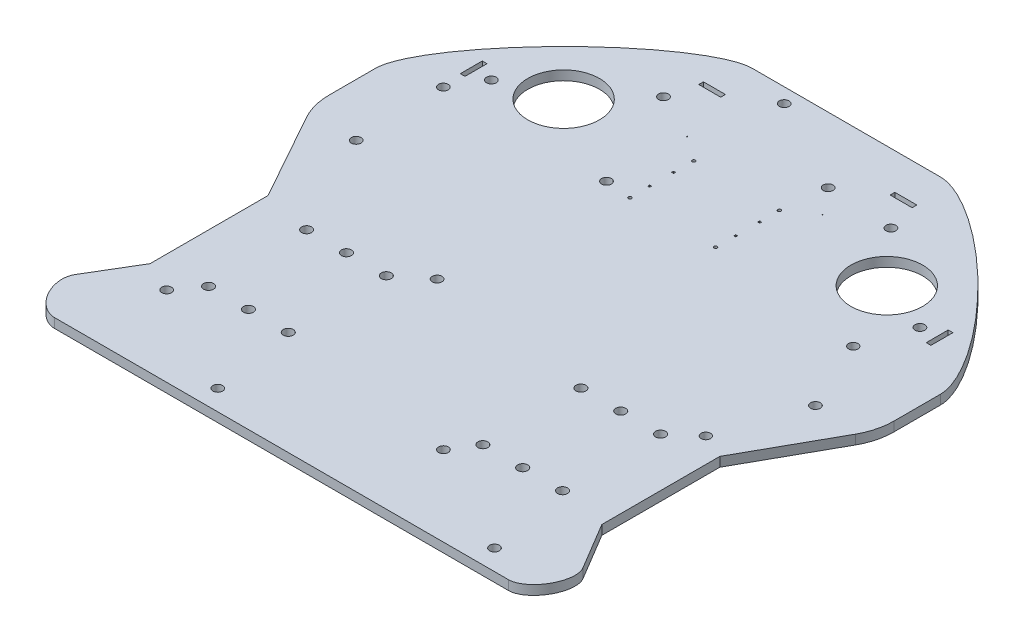
from build123d import *

# Parameters (mm, degrees)
SKETCH1_W           = 80
SKETCH1_H           = 30
SKETCH1_W_2         = 50
BOSS_EXTRUDE1_DEPTH = 3
FILLET1_SIZE        = 60
SKETCH6_W           = 80
SKETCH6_H           = 30
CUT_EXTRUDE1_DEPTH  = 10
FILLET3_R           = 20
SKETCH8_R           = 1.55
SKETCH8_R_2         = 11.43
SKETCH8_R_3         = 1.5875
SKETCH8_R_4         = 1.5
SKETCH8_W           = 7
SKETCH8_H           = 1.5
SKETCH8_W_2         = 1.5
SKETCH8_H_2         = 7
CUT_EXTRUDE2_DEPTH  = 3
CUT_EXTRUDE3_REACH  = 256.576
SKETCH9_R           = 1.55
SKETCH9_R_2         = 0.5
SKETCH9_W           = 0.24
SKETCH9_H           = 0.24
SKETCH9_W_2         = 0.635
SKETCH9_H_2         = 0.635


with BuildPart() as part:
    # Sketch1 → Boss-Extrude1 (new body)
    with BuildSketch(Plane(origin=(0, 0, 0), x_dir=(1, 0, 0), z_dir=(0, 1, 0))):
        with Locations((-90, -15)):
            Rectangle(SKETCH1_W, SKETCH1_H)
        Polygon((0, 180), (-180, 180), (-180, 30), (-130, 30), (-50, 30), (0, 30), align=None)
        with Locations((-25, 15)):
            Rectangle(SKETCH1_W_2, SKETCH1_H)
        with Locations((-155, 15)):
            Rectangle(SKETCH1_W_2, SKETCH1_H)
        with Locations((-90, 15)):
            Rectangle(SKETCH1_W, SKETCH1_H)
    extrude(amount=BOSS_EXTRUDE1_DEPTH)

    # Fillet1
    # a fillet whose section is not a circle: 60 mm, written as the material it takes off along each edge
    with BuildSketch(Plane(origin=(0, -150, -180), x_dir=(0, 0, 1), z_dir=(0, 1, 0)), Plane(origin=(-180, -150, -180), x_dir=(1, 0, 0), z_dir=(0, 1, 0))) as fillet1_piece_1:
        with BuildLine():
            Bezier((FILLET1_SIZE, 0), (0, 0), (0, -FILLET1_SIZE), weights=[1, 0.25, 1])
            Line((0, -FILLET1_SIZE), (0, 0))
            Line((0, 0), (FILLET1_SIZE, 0))
        make_face()
    extrude(amount=303, mode=Mode.SUBTRACT)

    # Sketch6 → Cut-Extrude1 (cut)
    with BuildSketch(Plane(origin=(0, 3, 0), x_dir=(1, 0, 0), z_dir=(0, 1, 0))):
        with Locations((-90, -15)):
            Rectangle(SKETCH6_W, SKETCH6_H)
        Polygon((-180, 100), (-180, 0), (-162, 30.1112758), (-162, 67.7112758), align=None)
        Polygon((-18, 30.1112758), (0, 0), (0, 100), (-18, 67.7112758), align=None)
    extrude(amount=-CUT_EXTRUDE1_DEPTH, mode=Mode.SUBTRACT)

    # Fillet2
    # a fillet whose section is not a circle: 10 mm, written as the material it takes off along each edge
    with BuildSketch(Plane(origin=(-180, -44.070846291, 0), x_dir=(1, 0, 0), z_dir=(0, 1, 0)), Plane(origin=(0, -44.070846291, 0), x_dir=(-0.513095679808488, 0, -0.8583314181374613), z_dir=(0, 1, 0))) as fillet2_piece_1:
        with BuildLine():
            Bezier((17.628338516, 0), (0, 0), (9.045024335, 15.130956798), weights=[1, 0.333333333, 1])
            Line((9.045024335, 15.130956798), (0, 0))
            Line((0, 0), (17.628338516, 0))
        make_face()
    extrude(amount=91.141692581, mode=Mode.SUBTRACT)

    # Fillet3
    fillet3_edges = [part.edges().sort_by_distance(p)[0] for p in [
        (0, 1.5, -100),
        (-180, 1.5, -100),
    ]]
    fillet(fillet3_edges, radius=FILLET3_R)

    # Sketch8 → Cut-Extrude2 (cut)
    with BuildSketch(Plane(origin=(0, 3, 0), x_dir=(1, 0, 0), z_dir=(0, 1, 0))):
        with Locations(Location((-105.104964584, 175.33109831, 0), (0, 0, 270))):
            Circle(SKETCH8_R)
        with Locations(Location((-74.900170028, 159.13122779, 0), (0, 0, 270))):
            Circle(SKETCH8_R)
        with Locations(Location((-141.5, 141.43, 0), (0, 0, 270))):
            Circle(SKETCH8_R_2)
        with Locations(Location((-38.5, 141.43, 0), (0, 0, 270))):
            Circle(SKETCH8_R_2)
        with Locations(Location((-112, 125.592, 0), (0, 0, 270))):
            Circle(SKETCH8_R)
        with Locations(Location((-164, 125.592, 0), (0, 0, 270))):
            Circle(SKETCH8_R)
        with Locations(Location((-112, 71.592, 0), (0, 0, 270))):
            Circle(SKETCH8_R)
        with Locations(Location((-146.4125, 64.417, 0), (0, 0, 270))):
            Circle(SKETCH8_R_3)
        with Locations(Location((-133.7125, 64.417, 0), (0, 0, 270))):
            Circle(SKETCH8_R_3)
        with Locations(Location((-121.0125, 64.417, 0), (0, 0, 270))):
            Circle(SKETCH8_R_3)
        with Locations(Location((-146.4125, 33.175, 0), (0, 0, 270))):
            Circle(SKETCH8_R_3)
        with Locations(Location((-133.7125, 33.175, 0), (0, 0, 270))):
            Circle(SKETCH8_R_3)
        with Locations(Location((-121.0125, 33.175, 0), (0, 0, 270))):
            Circle(SKETCH8_R_3)
        with Locations(Location((-58.9875, 64.417, 0), (0, 0, 270))):
            Circle(SKETCH8_R_3)
        with Locations(Location((-46.2875, 64.417, 0), (0, 0, 270))):
            Circle(SKETCH8_R_3)
        with Locations(Location((-33.5875, 64.417, 0), (0, 0, 270))):
            Circle(SKETCH8_R_3)
        with Locations(Location((-33.5875, 33.175, 0), (0, 0, 270))):
            Circle(SKETCH8_R_3)
        with Locations(Location((-46.2875, 33.175, 0), (0, 0, 270))):
            Circle(SKETCH8_R_3)
        with Locations(Location((-58.9875, 33.175, 0), (0, 0, 270))):
            Circle(SKETCH8_R_3)
        with Locations(Location((-63.9, 25.5, 0), (0, 0, 270))):
            Circle(SKETCH8_R)
        with Locations(Location((-28.6, 6.5, 0), (0, 0, 270))):
            Circle(SKETCH8_R)
        with Locations(Location((-116.8, 6.5, 0), (0, 0, 270))):
            Circle(SKETCH8_R)
        with Locations(Location((-152.1, 25.5, 0), (0, 0, 270))):
            Circle(SKETCH8_R)
        with Locations(Location((-27.14, 119.392, 0), (0, 0, 270))):
            Circle(SKETCH8_R_4)
        with Locations(Location((-25.87, 71.132, 0), (0, 0, 270))):
            Circle(SKETCH8_R_4)
        with Locations((-59.5, 167.75)):
            Rectangle(SKETCH8_W, SKETCH8_H)
        with Locations((-120.5, 167.75)):
            Rectangle(SKETCH8_W, SKETCH8_H)
        with Locations((-164.25, 135.5)):
            Rectangle(SKETCH8_W_2, SKETCH8_H_2)
        with Locations((-15.75, 135.5)):
            Rectangle(SKETCH8_W_2, SKETCH8_H_2)
    extrude(amount=-CUT_EXTRUDE2_DEPTH, mode=Mode.SUBTRACT)

    # Sketch9 → Cut-Extrude3 (cut, up to next)
    with BuildSketch(Plane.XZ, mode=Mode.PRIVATE) as cut_extrude3_sk1:
        with Locations(Location((-163.2, -97, 0), (0, 0, 270))):
            Circle(SKETCH9_R)
    cut_extrude3_tool1 = extrude(cut_extrude3_sk1.sketch, amount=-CUT_EXTRUDE3_REACH, mode=Mode.PRIVATE) & part.part
    # Sketch9 → Cut-Extrude3 (cut, up to next)
    with BuildSketch(Plane.XZ, mode=Mode.PRIVATE) as cut_extrude3_sk2:
        with Locations(Location((-158.3, -135.2, 0), (0, 0, 270))):
            Circle(SKETCH9_R)
    cut_extrude3_tool2 = extrude(cut_extrude3_sk2.sketch, amount=-CUT_EXTRUDE3_REACH, mode=Mode.PRIVATE) & part.part
    # Sketch9 → Cut-Extrude3 (cut, up to next)
    with BuildSketch(Plane.XZ, mode=Mode.PRIVATE) as cut_extrude3_sk3:
        with Locations(Location((-126.25, -158, 0), (0, 0, 270))):
            Circle(SKETCH9_R)
    cut_extrude3_tool3 = extrude(cut_extrude3_sk3.sketch, amount=-CUT_EXTRUDE3_REACH, mode=Mode.PRIVATE) & part.part
    # Sketch9 → Cut-Extrude3 (cut, up to next)
    with BuildSketch(Plane.XZ, mode=Mode.PRIVATE) as cut_extrude3_sk4:
        with Locations(Location((-53.75, -158, 0), (0, 0, 270))):
            Circle(SKETCH9_R)
    cut_extrude3_tool4 = extrude(cut_extrude3_sk4.sketch, amount=-CUT_EXTRUDE3_REACH, mode=Mode.PRIVATE) & part.part
    # Sketch9 → Cut-Extrude3 (cut, up to next)
    with BuildSketch(Plane.XZ, mode=Mode.PRIVATE) as cut_extrude3_sk5:
        with Locations(Location((-21.7, -135.2, 0), (0, 0, 270))):
            Circle(SKETCH9_R)
    cut_extrude3_tool5 = extrude(cut_extrude3_sk5.sketch, amount=-CUT_EXTRUDE3_REACH, mode=Mode.PRIVATE) & part.part
    # Sketch9 → Cut-Extrude3 (cut, up to next)
    with BuildSketch(Plane.XZ, mode=Mode.PRIVATE) as cut_extrude3_sk6:
        with Locations(Location((-16.8, -97, 0), (0, 0, 270))):
            Circle(SKETCH9_R)
    cut_extrude3_tool6 = extrude(cut_extrude3_sk6.sketch, amount=-CUT_EXTRUDE3_REACH, mode=Mode.PRIVATE) & part.part
    # Sketch9 → Cut-Extrude3 (cut, up to next)
    with BuildSketch(Plane.XZ, mode=Mode.PRIVATE) as cut_extrude3_sk7:
        with Locations(Location((-76.405, -124.775, 0), (0, 0, 270))):
            Circle(SKETCH9_R_2)
    cut_extrude3_tool7 = extrude(cut_extrude3_sk7.sketch, amount=-CUT_EXTRUDE3_REACH, mode=Mode.PRIVATE) & part.part
    # Sketch9 → Cut-Extrude3 (cut, up to next)
    with BuildSketch(Plane.XZ, mode=Mode.PRIVATE) as cut_extrude3_sk8:
        with Locations(Location((-103.71, -145.095, 0), (0, 0, 270))):
            Circle(SKETCH9_R_2)
    cut_extrude3_tool8 = extrude(cut_extrude3_sk8.sketch, amount=-CUT_EXTRUDE3_REACH, mode=Mode.PRIVATE) & part.part
    # Sketch9 → Cut-Extrude3 (cut, up to next)
    with BuildSketch(Plane.XZ, mode=Mode.PRIVATE) as cut_extrude3_sk9:
        with Locations(Location((-76.405, -145.095, 0), (0, 0, 270))):
            Circle(SKETCH9_R_2)
    cut_extrude3_tool9 = extrude(cut_extrude3_sk9.sketch, amount=-CUT_EXTRUDE3_REACH, mode=Mode.PRIVATE) & part.part
    # Sketch9 → Cut-Extrude3 (cut, up to next)
    with BuildSketch(Plane.XZ, mode=Mode.PRIVATE) as cut_extrude3_sk10:
        with Locations(Location((-103.71, -124.775, 0), (0, 0, 270))):
            Circle(SKETCH9_R_2)
    cut_extrude3_tool10 = extrude(cut_extrude3_sk10.sketch, amount=-CUT_EXTRUDE3_REACH, mode=Mode.PRIVATE) & part.part
    # Sketch9 → Cut-Extrude3 (cut, up to next)
    with BuildSketch(Plane.XZ, mode=Mode.PRIVATE) as cut_extrude3_sk11:
        with Locations((-68.3, -150.77)):
            Rectangle(SKETCH9_W, SKETCH9_H)
    cut_extrude3_tool11 = extrude(cut_extrude3_sk11.sketch, amount=-CUT_EXTRUDE3_REACH, mode=Mode.PRIVATE) & part.part
    # Sketch9 → Cut-Extrude3 (cut, up to next)
    with BuildSketch(Plane.XZ, mode=Mode.PRIVATE) as cut_extrude3_sk12:
        with Locations((-111.48, -150.77)):
            Rectangle(SKETCH9_W, SKETCH9_H)
    cut_extrude3_tool12 = extrude(cut_extrude3_sk12.sketch, amount=-CUT_EXTRUDE3_REACH, mode=Mode.PRIVATE) & part.part
    # Sketch9 → Cut-Extrude3 (cut, up to next)
    with BuildSketch(Plane.XZ, mode=Mode.PRIVATE) as cut_extrude3_sk13:
        with Locations((-76.3275, -138.745)):
            Rectangle(SKETCH9_W_2, SKETCH9_H_2)
    cut_extrude3_tool13 = extrude(cut_extrude3_sk13.sketch, amount=-CUT_EXTRUDE3_REACH, mode=Mode.PRIVATE) & part.part
    # Sketch9 → Cut-Extrude3 (cut, up to next)
    with BuildSketch(Plane.XZ, mode=Mode.PRIVATE) as cut_extrude3_sk14:
        with Locations((-76.3275, -131.125)):
            Rectangle(SKETCH9_W_2, SKETCH9_H_2)
    cut_extrude3_tool14 = extrude(cut_extrude3_sk14.sketch, amount=-CUT_EXTRUDE3_REACH, mode=Mode.PRIVATE) & part.part
    # Sketch9 → Cut-Extrude3 (cut, up to next)
    with BuildSketch(Plane.XZ, mode=Mode.PRIVATE) as cut_extrude3_sk15:
        with Locations((-103.7875, -138.745)):
            Rectangle(SKETCH9_W_2, SKETCH9_H_2)
    cut_extrude3_tool15 = extrude(cut_extrude3_sk15.sketch, amount=-CUT_EXTRUDE3_REACH, mode=Mode.PRIVATE) & part.part
    # Sketch9 → Cut-Extrude3 (cut, up to next)
    with BuildSketch(Plane.XZ, mode=Mode.PRIVATE) as cut_extrude3_sk16:
        with Locations((-103.7875, -131.125)):
            Rectangle(SKETCH9_W_2, SKETCH9_H_2)
    cut_extrude3_tool16 = extrude(cut_extrude3_sk16.sketch, amount=-CUT_EXTRUDE3_REACH, mode=Mode.PRIVATE) & part.part
    add(cut_extrude3_tool1.solids().sort_by_distance((-163.2, 0, -97))[0], mode=Mode.SUBTRACT)
    add(cut_extrude3_tool2.solids().sort_by_distance((-158.3, 0, -135.2))[0], mode=Mode.SUBTRACT)
    add(cut_extrude3_tool3.solids().sort_by_distance((-126.25, 0, -158))[0], mode=Mode.SUBTRACT)
    add(cut_extrude3_tool4.solids().sort_by_distance((-53.75, 0, -158))[0], mode=Mode.SUBTRACT)
    add(cut_extrude3_tool5.solids().sort_by_distance((-21.7, 0, -135.2))[0], mode=Mode.SUBTRACT)
    add(cut_extrude3_tool6.solids().sort_by_distance((-16.8, 0, -97))[0], mode=Mode.SUBTRACT)
    add(cut_extrude3_tool7.solids().sort_by_distance((-76.405, 0, -124.775))[0], mode=Mode.SUBTRACT)
    add(cut_extrude3_tool8.solids().sort_by_distance((-103.71, 0, -145.095))[0], mode=Mode.SUBTRACT)
    add(cut_extrude3_tool9.solids().sort_by_distance((-76.405, 0, -145.095))[0], mode=Mode.SUBTRACT)
    add(cut_extrude3_tool10.solids().sort_by_distance((-103.71, 0, -124.775))[0], mode=Mode.SUBTRACT)
    add(cut_extrude3_tool11.solids().sort_by_distance((-68.3, 0, -150.77))[0], mode=Mode.SUBTRACT)
    add(cut_extrude3_tool12.solids().sort_by_distance((-111.48, 0, -150.77))[0], mode=Mode.SUBTRACT)
    add(cut_extrude3_tool13.solids().sort_by_distance((-76.3275, 0, -138.745))[0], mode=Mode.SUBTRACT)
    add(cut_extrude3_tool14.solids().sort_by_distance((-76.3275, 0, -131.125))[0], mode=Mode.SUBTRACT)
    add(cut_extrude3_tool15.solids().sort_by_distance((-103.7875, 0, -138.745))[0], mode=Mode.SUBTRACT)
    add(cut_extrude3_tool16.solids().sort_by_distance((-103.7875, 0, -131.125))[0], mode=Mode.SUBTRACT)


solid = part.part
